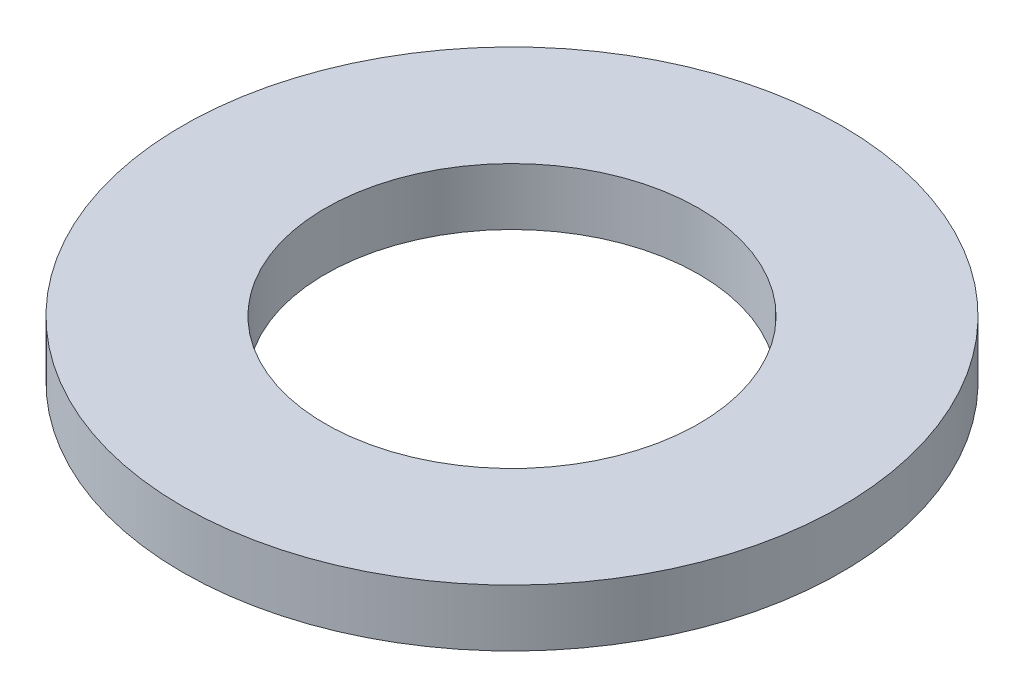
from build123d import *

# Parameters (mm, degrees)
SKETCH1_R           = 75
BOSS_EXTRUDE1_DEPTH = 13
SKETCH2_R           = 42.5
CUT_EXTRUDE1_DEPTH  = 107.85972113


with BuildPart() as part:
    # Sketch1 → Boss-Extrude1 (new body)
    with BuildSketch(Plane(origin=(0, 0, 0), x_dir=(1, 0, 0), z_dir=(0, 1, 0))):
        Circle(SKETCH1_R)
    extrude(amount=BOSS_EXTRUDE1_DEPTH)

    # Sketch2 → Cut-Extrude1 (cut, through all)
    with BuildSketch(Plane(origin=(0, 0, 0), x_dir=(1, 0, 0), z_dir=(0, 1, 0))):
        Circle(SKETCH2_R)
    extrude(amount=CUT_EXTRUDE1_DEPTH, mode=Mode.SUBTRACT)


solid = part.part
